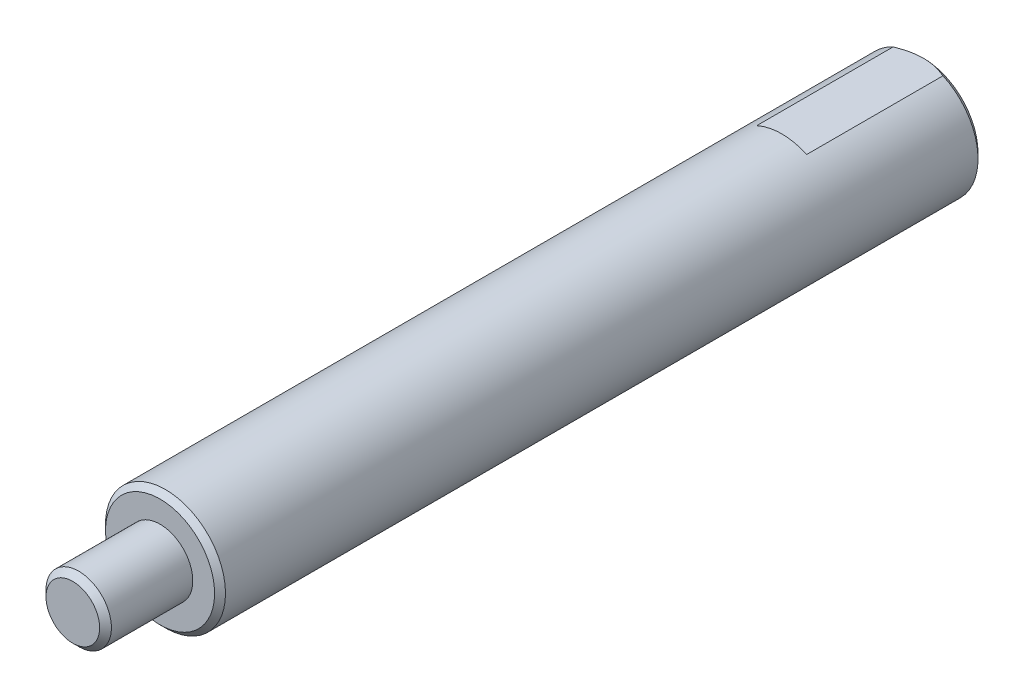
from build123d import *

# Parameters (mm, degrees)
SKETCH_1_R             = 5.5
EXTRUDE_1_DEPTH        = 70
CHAMFER_1_SIZE         = 0.5
SKETCH_2_R             = 3.3
EXTRUDE_2_DEPTH        = 8
HOLE_WIZARD_M5_1_D     = 4.2
HOLE_WIZARD_M5_1_DEPTH = 12.4
HOLE_WIZARD_M5_1_TIP   = 1.2618073
CHAMFER_3_SIZE         = 0.5
SKETCH_6_W             = 10
SKETCH_6_H             = 3
CUT_EXTRUDE_1_DEPTH    = 13


# Read off the part's stored shape, not the designer's step: M6 机械螺纹 螺柱1
with BuildPart() as part:
    # 草图1 → 拉伸1 (new body)
    with BuildSketch(Plane.XY):
        Circle(SKETCH_1_R)
    extrude(amount=EXTRUDE_1_DEPTH)

    # 倒角1
    chamfer_1_edges = [part.edges().sort_by_distance(p)[0] for p in [
        (-5.5, 0, 0),
        (-5.5, 0, 70),
    ]]
    chamfer(chamfer_1_edges, length=CHAMFER_1_SIZE)

    # 草图2 → 拉伸2 (add)
    with BuildSketch(Plane.XY.offset(70)):
        Circle(SKETCH_2_R)
    extrude(amount=EXTRUDE_2_DEPTH)

    # M5 螺纹孔1
    with Locations(Plane(origin=(0, 0, 0), x_dir=(-1, 0, 0), z_dir=(0, 0, -1))):
        with Locations((0, 0)):
            Hole(HOLE_WIZARD_M5_1_D / 2, depth=HOLE_WIZARD_M5_1_DEPTH)
            with Locations((0, 0, -(HOLE_WIZARD_M5_1_DEPTH + HOLE_WIZARD_M5_1_TIP / 2))):  # 118° drill point
                Cone(0, HOLE_WIZARD_M5_1_D / 2, HOLE_WIZARD_M5_1_TIP, mode=Mode.SUBTRACT)

    # 倒角3
    chamfer_3_edges = [part.edges().sort_by_distance(p)[0] for p in [
        (-2.1, 0, 0),
    ]]
    chamfer(chamfer_3_edges, length=CHAMFER_3_SIZE)

    # 草图6 → 切除-拉伸1 (cut)
    with BuildSketch(Plane(origin=(0, 0, 0), x_dir=(-1, 0, 0), z_dir=(0, 0, -1))):
        with Locations((0, 6.5)):
            Rectangle(SKETCH_6_W, SKETCH_6_H)
        with Locations((0, -6.5)):
            Rectangle(SKETCH_6_W, SKETCH_6_H)
    extrude(amount=-CUT_EXTRUDE_1_DEPTH, mode=Mode.SUBTRACT)

    # M6 机械螺纹 螺柱1 outline → M6 机械螺纹 螺柱1 (revolve, cut)
    with BuildSketch(Plane.XZ):
        Polygon((3.3, 78), (2.4585, 78), (3, 77.4585), (3, 70), (3.3, 70), align=None)
    revolve(axis=Axis((0, 0, 0), (0, 0, 1)), mode=Mode.SUBTRACT)


solid = part.part
